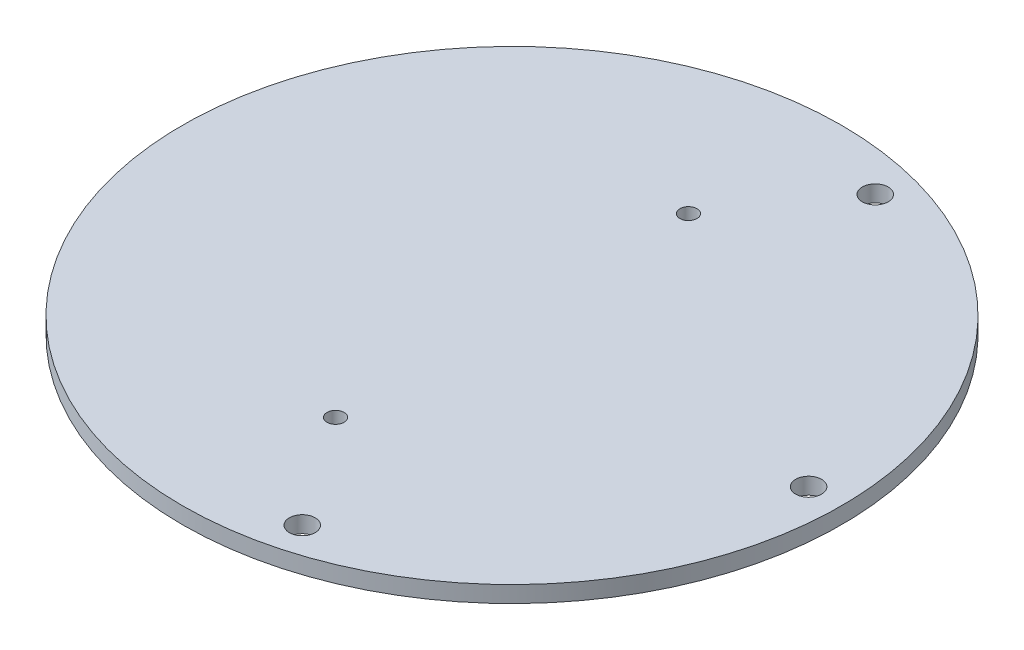
from build123d import *

# Parameters (mm, degrees)
SKETCH1_R                   = 63.5
BOSS_EXTRUDE1_DEPTH         = 3.175
TAP_DRILL_FOR_M4X0_7_TAP1_D = 3.3
F_9_0_196_DIAMETER_HOLE1_D  = 4.9784


with BuildPart() as part:
    # Sketch1 → Boss-Extrude1 (new body)
    with BuildSketch(Plane(origin=(0, 0, 0), x_dir=(1, 0, 0), z_dir=(0, 1, 0))):
        Circle(SKETCH1_R)
    extrude(amount=BOSS_EXTRUDE1_DEPTH)

    # Tap Drill for M4x0.7 Tap1 (through all)
    with Locations(Plane(origin=(0, 3.175, 0), x_dir=(1, 0, 0), z_dir=(0, 1, 0))):
        with Locations((0, 34), (0, -34)):
            Hole(TAP_DRILL_FOR_M4X0_7_TAP1_D / 2)

    # #9 (0.196) Diameter Hole1 (through all)
    with Locations(Plane(origin=(0, 3.175, 0), x_dir=(1, 0, 0), z_dir=(0, 1, 0))):
        with Locations((14.791508428, 55.202660972), (57.15, 0), (14.791508428, -55.202660972)):
            Hole(F_9_0_196_DIAMETER_HOLE1_D / 2)


solid = part.part
